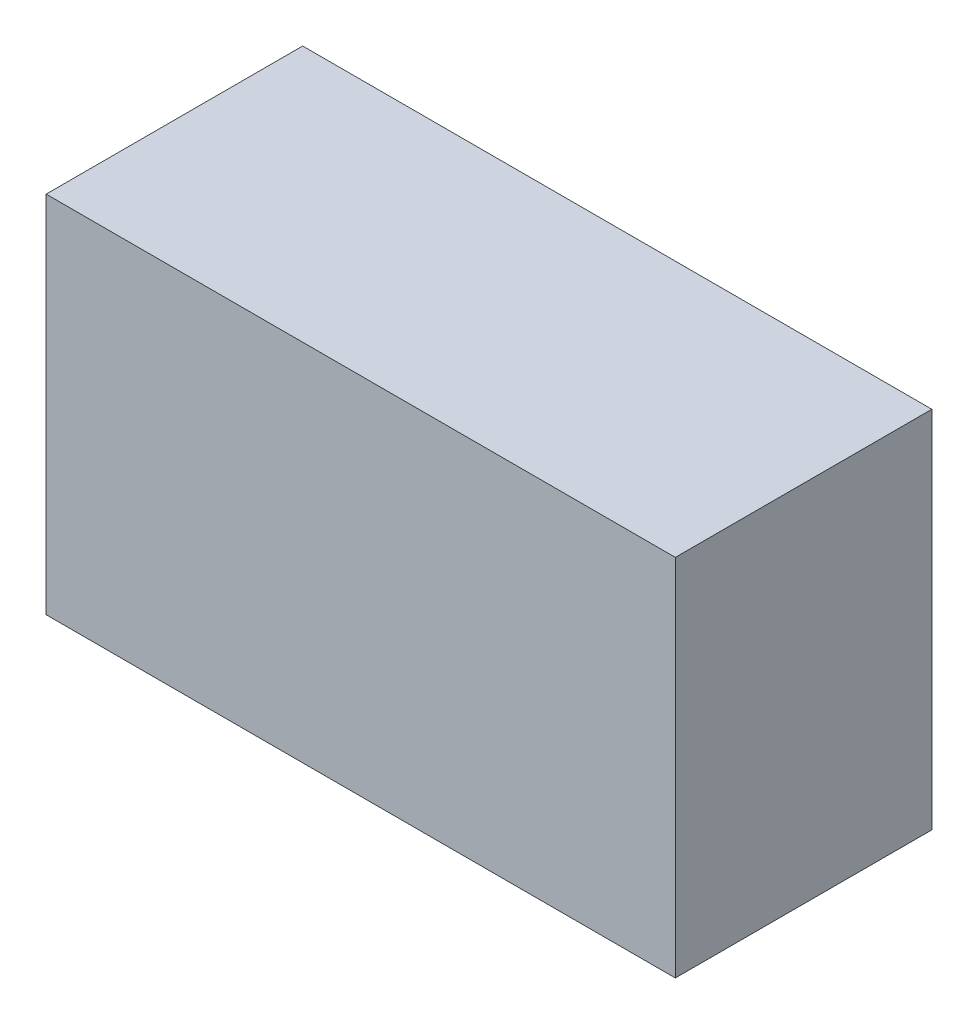
from build123d import *
from build123d.topology import SkipClean

# Parameters (mm, degrees)
SKETCH3_W                      = 31.148374891
SKETCH3_H                      = 19.837641971
BOSS_EXTRUDE1_DEPTH            = 6.35
SKETCH4_R                      = 3.175
CUT_EXTRUDE1_DEPTH             = 9.525
SKETCH5_R                      = 3.175
CUT_EXTRUDE5_DEPTH             = 9.525
CUT_EXTRUDE5_DIRECTION_2_REACH = 33.299
SKETCH6_R                      = 3.175
CUT_EXTRUDE6_DEPTH             = 9.525
SKETCH7_W                      = 12.7
SKETCH7_H                      = 1.803641971
CUT_EXTRUDE7_DEPTH             = 38.470999417


with BuildPart() as part:
    # Sketch3 → Boss-Extrude1 (new, symmetric)
    with BuildSketch(Plane.XY):
        with Locations((15.574187446, -9.918820986)):
            Rectangle(SKETCH3_W, SKETCH3_H)
    extrude(amount=BOSS_EXTRUDE1_DEPTH, both=True)

    # Sketch4 → Cut-Extrude1 (cut)
    with BuildSketch(Plane.ZY):
        with Locations((0, -6.35)):
            Circle(SKETCH4_R)
    extrude(amount=-CUT_EXTRUDE1_DEPTH, mode=Mode.SUBTRACT)

    # Sketch5 → Cut-Extrude5 (cut)
    with BuildSketch(Plane(origin=(7.787093723, -19.837641971, 0), x_dir=(-0.8660254037844382, 0.500000000000001, 0), z_dir=(-0.500000000000001, -0.8660254037844382, 0))):
        Circle(SKETCH5_R)
    cut_extrude5 = extrude(amount=-CUT_EXTRUDE5_DEPTH, mode=Mode.SUBTRACT)

    # Sketch5 → Cut-Extrude5 direction 2 (cut, up to next)
    with BuildSketch(Plane(origin=(7.787093723, -19.837641971, 0), x_dir=(-0.8660254037844382, 0.500000000000001, 0), z_dir=(-0.500000000000001, -0.8660254037844382, 0)), mode=Mode.PRIVATE) as cut_extrude5_direction_2_sk1:
        Circle(SKETCH5_R)
    cut_extrude5_direction_2_tool1 = extrude(cut_extrude5_direction_2_sk1.sketch, amount=CUT_EXTRUDE5_DIRECTION_2_REACH, mode=Mode.PRIVATE) & part.part
    cut_extrude5_direction_2 = cut_extrude5_direction_2_tool1.solids().sort_by_distance((7.787094, -19.837642, 0))[0]
    add(cut_extrude5_direction_2, mode=Mode.SUBTRACT)

    # Sketch6 → Cut-Extrude6 (cut)
    with BuildSketch(Plane(origin=(0, 0, -6.35), x_dir=(-1, 0, 0), z_dir=(0, 0, -1))):
        with Locations((-15.574187445, -6.35)):
            Circle(SKETCH6_R)
    extrude(amount=-CUT_EXTRUDE6_DEPTH, mode=Mode.SUBTRACT)

    # Mirror1: Cut-Extrude5, Cut-Extrude5 direction 2 across plane
    with SkipClean():  # the faces are left unmerged after this step: merging them gives an invalid solid
        add(cut_extrude5.mirror(Plane.ZY.offset(-15.574187445)), mode=Mode.SUBTRACT)
        add(cut_extrude5_direction_2.mirror(Plane.ZY.offset(-15.574187445)), mode=Mode.SUBTRACT)

    # Sketch7 → Cut-Extrude7 (cut, through all)
    with BuildSketch(Plane(origin=(31.148374891, 0, 0), x_dir=(0, 0, -1), z_dir=(1, 0, 0))):
        with Locations((0, -18.935820986)):
            Rectangle(SKETCH7_W, SKETCH7_H)
    extrude(amount=-CUT_EXTRUDE7_DEPTH, mode=Mode.SUBTRACT)


solid = part.part
